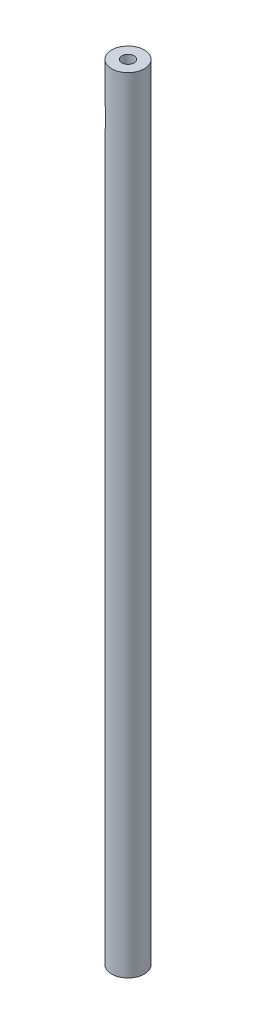
from build123d import *

# Parameters (mm, degrees)
SKETCH1_R           = 12.7
SKETCH1_R_2         = 4.7625
BOSS_EXTRUDE1_DEPTH = 609.6
SKETCH3_R           = 12.7
CUT_EXTRUDE1_DEPTH  = 6.35


with BuildPart() as part:
    # Sketch1 → Boss-Extrude1 (new body)
    with BuildSketch(Plane(origin=(0, 0, 0), x_dir=(1, 0, 0), z_dir=(0, 1, 0))):
        Circle(SKETCH1_R)
        Circle(SKETCH1_R_2, mode=Mode.SUBTRACT)
    extrude(amount=BOSS_EXTRUDE1_DEPTH)

    # Sketch3 → Cut-Extrude1 (cut)
    with BuildSketch(Plane.ZY.offset(12.7)):
        with Locations((0, 571.754)):
            Circle(SKETCH3_R)
    extrude(amount=-CUT_EXTRUDE1_DEPTH, mode=Mode.SUBTRACT)


solid = part.part
